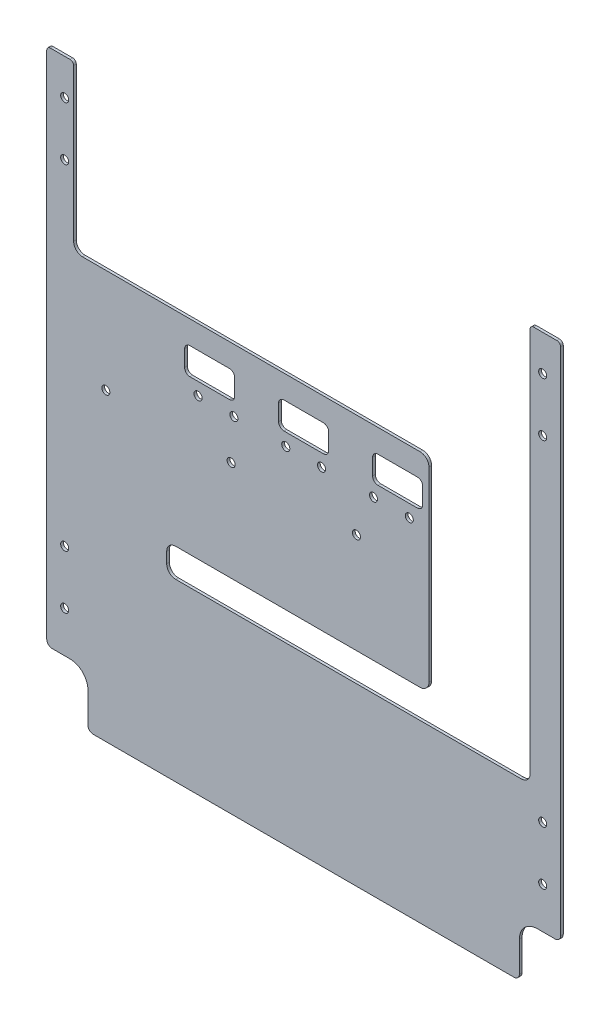
from build123d import *

# Parameters (mm, degrees)
ESQUISSE1_W                  = 287
ESQUISSE1_H                  = 320
BOSS_EXTRU_1_DEPTH           = 1.5
ENL_V_MAT_EXTRU_1_DEPTH      = 430.850264627
ENL_V_MAT_EXTRU_1_DEPTH_BACK = 430.850264627
ESQUISSE2_W                  = 23
ESQUISSE2_H                  = 30
CONG_1_R                     = 10
CONG_2_R                     = 3
ENL_V_MAT_EXTRU_2_DEPTH      = 430.850264627
ENL_V_MAT_EXTRU_2_DEPTH_BACK = 430.850264627
ESQUISSE3_W                  = 140
ESQUISSE3_H                  = 92
ENL_V_MAT_EXTRU_3_DEPTH      = 430.850264627
ENL_V_MAT_EXTRU_3_DEPTH_BACK = 430.850264627
ESQUISSE4_W                  = 56.5
ESQUISSE4_H                  = 222
ENL_V_MAT_EXTRU_4_DEPTH      = 430.850264627
ENL_V_MAT_EXTRU_4_DEPTH_BACK = 430.850264627
ESQUISSE5_W                  = 58.5
ESQUISSE5_H                  = 92
ENL_V_MAT_EXTRU_5_DEPTH      = 430.850264627
ENL_V_MAT_EXTRU_5_DEPTH_BACK = 430.850264627
ESQUISSE6_W                  = 146.5
ESQUISSE6_H                  = 16
CONG_3_R                     = 5
ENL_V_MAT_EXTRU_6_DEPTH      = 430.850264627
ENL_V_MAT_EXTRU_6_DEPTH_BACK = 430.850264627
ESQUISSE7_R                  = 2.25
ENL_V_MAT_EXTRU_7_DEPTH      = 430.850264627
ENL_V_MAT_EXTRU_7_DEPTH_BACK = 430.850264627
ESQUISSE8_R                  = 2.25
ENL_V_MAT_EXTRU_8_DEPTH      = 430.850264627
ENL_V_MAT_EXTRU_8_DEPTH_BACK = 430.850264627
ESQUISSE9_W                  = 28
ESQUISSE9_H                  = 15
CONG_4_R                     = 3
CONG_6_R                     = 2


with BuildPart() as part:
    # Esquisse1 → Boss.-Extru.1 (new body)
    with BuildSketch(Plane.XY):
        with Locations((143.5, 160)):
            Rectangle(ESQUISSE1_W, ESQUISSE1_H)
    extrude(amount=BOSS_EXTRU_1_DEPTH)

    # Esquisse2 → Enlèv. mat.-Extru.1 (cut, two sides: drawn at the far end of the back side and taken through both)
    with BuildSketch(Plane.XY.offset(1.5).offset(-ENL_V_MAT_EXTRU_1_DEPTH_BACK)):
        with Locations((275.5, 15)):
            Rectangle(ESQUISSE2_W, ESQUISSE2_H)
        with Locations((11.5, 15)):
            Rectangle(ESQUISSE2_W, ESQUISSE2_H)
    extrude(amount=ENL_V_MAT_EXTRU_1_DEPTH + ENL_V_MAT_EXTRU_1_DEPTH_BACK, mode=Mode.SUBTRACT)

    # Congé1
    cong_1_edges = [part.edges().sort_by_distance(p)[0] for p in [
        (264, 30, 0.75),
        (23, 30, 0.75),
    ]]
    fillet(cong_1_edges, radius=CONG_1_R)

    # Congé2
    cong_2_edges = [part.edges().sort_by_distance(p)[0] for p in [
        (287, 30, 0.75),
        (0, 30, 0.75),
        (23, 0, 0.75),
        (264, 0, 0.75),
    ]]
    fillet(cong_2_edges, radius=CONG_2_R)

    # Esquisse3 → Enlèv. mat.-Extru.2 (cut, two sides: drawn at the far end of the back side and taken through both)
    with BuildSketch(Plane.XY.offset(1.5).offset(-ENL_V_MAT_EXTRU_2_DEPTH_BACK)):
        with Locations((143.5, 274)):
            Rectangle(ESQUISSE3_W, ESQUISSE3_H)
    extrude(amount=ENL_V_MAT_EXTRU_2_DEPTH + ENL_V_MAT_EXTRU_2_DEPTH_BACK, mode=Mode.SUBTRACT)

    # Esquisse4 → Enlèv. mat.-Extru.3 (cut, two sides: drawn at the far end of the back side and taken through both)
    with BuildSketch(Plane.XY.offset(1.5).offset(-ENL_V_MAT_EXTRU_3_DEPTH_BACK)):
        with Locations((241.75, 209)):
            Rectangle(ESQUISSE4_W, ESQUISSE4_H)
    extrude(amount=ENL_V_MAT_EXTRU_3_DEPTH + ENL_V_MAT_EXTRU_3_DEPTH_BACK, mode=Mode.SUBTRACT)

    # Esquisse5 → Enlèv. mat.-Extru.4 (cut, two sides: drawn at the far end of the back side and taken through both)
    with BuildSketch(Plane.XY.offset(1.5).offset(-ENL_V_MAT_EXTRU_4_DEPTH_BACK)):
        with Locations((44.25, 274)):
            Rectangle(ESQUISSE5_W, ESQUISSE5_H)
    extrude(amount=ENL_V_MAT_EXTRU_4_DEPTH + ENL_V_MAT_EXTRU_4_DEPTH_BACK, mode=Mode.SUBTRACT)

    # Esquisse6 → Enlèv. mat.-Extru.5 (cut, two sides: drawn at the far end of the back side and taken through both)
    with BuildSketch(Plane.XY.offset(1.5).offset(-ENL_V_MAT_EXTRU_5_DEPTH_BACK)):
        with Locations((140.25, 106)):
            Rectangle(ESQUISSE6_W, ESQUISSE6_H)
    extrude(amount=ENL_V_MAT_EXTRU_5_DEPTH + ENL_V_MAT_EXTRU_5_DEPTH_BACK, mode=Mode.SUBTRACT)

    # Congé3
    cong_3_edges = [part.edges().sort_by_distance(p)[0] for p in [
        (270, 98, 0.75),
        (67, 98, 0.75),
        (67, 114, 0.75),
        (213.5, 114, 0.75),
        (213.5, 228, 0.75),
        (15, 228, 0.75),
    ]]
    fillet(cong_3_edges, radius=CONG_3_R)

    # Esquisse7 → Enlèv. mat.-Extru.6 (cut, two sides: drawn at the far end of the back side and taken through both)
    with BuildSketch(Plane.XY.offset(1.5).offset(-ENL_V_MAT_EXTRU_6_DEPTH_BACK)):
        with Locations((277, 300)):
            Circle(ESQUISSE7_R)
        with Locations((277, 270)):
            Circle(ESQUISSE7_R)
        with Locations((10, 270)):
            Circle(ESQUISSE7_R)
        with Locations((10, 300)):
            Circle(ESQUISSE7_R)
        with Locations((277, 83)):
            Circle(ESQUISSE7_R)
        with Locations((277, 53)):
            Circle(ESQUISSE7_R)
        with Locations((10, 53)):
            Circle(ESQUISSE7_R)
        with Locations((10, 83)):
            Circle(ESQUISSE7_R)
        with Locations((33, 170)):
            Circle(ESQUISSE7_R)
        with Locations((103, 170)):
            Circle(ESQUISSE7_R)
        with Locations((173, 170)):
            Circle(ESQUISSE7_R)
    extrude(amount=ENL_V_MAT_EXTRU_6_DEPTH + ENL_V_MAT_EXTRU_6_DEPTH_BACK, mode=Mode.SUBTRACT)

    # Esquisse8 → Enlèv. mat.-Extru.7 (cut, two sides: drawn at the far end of the back side and taken through both)
    with BuildSketch(Plane.XY.offset(1.5).offset(-ENL_V_MAT_EXTRU_7_DEPTH_BACK)):
        with Locations((133.5, 193)):
            Circle(ESQUISSE8_R)
        with Locations((153.5, 193)):
            Circle(ESQUISSE8_R)
        with Locations((182.5, 193)):
            Circle(ESQUISSE8_R)
        with Locations((202.5, 193)):
            Circle(ESQUISSE8_R)
        with Locations((84.5, 193)):
            Circle(ESQUISSE8_R)
        with Locations((104.5, 193)):
            Circle(ESQUISSE8_R)
    extrude(amount=ENL_V_MAT_EXTRU_7_DEPTH + ENL_V_MAT_EXTRU_7_DEPTH_BACK, mode=Mode.SUBTRACT)

    # Esquisse9 → Enlèv. mat.-Extru.8 (cut, two sides: drawn at the far end of the back side and taken through both)
    with BuildSketch(Plane.XY.offset(1.5).offset(-ENL_V_MAT_EXTRU_8_DEPTH_BACK)):
        with Locations((143.5, 207.5)):
            Rectangle(ESQUISSE9_W, ESQUISSE9_H)
        with Locations((196, 207.5)):
            Rectangle(ESQUISSE9_W, ESQUISSE9_H)
        with Locations((91, 207.5)):
            Rectangle(ESQUISSE9_W, ESQUISSE9_H)
    extrude(amount=ENL_V_MAT_EXTRU_8_DEPTH + ENL_V_MAT_EXTRU_8_DEPTH_BACK, mode=Mode.SUBTRACT)

    # Congé4
    cong_4_edges = [part.edges().sort_by_distance(p)[0] for p in [
        (157.5, 200, 0.75),
        (157.5, 215, 0.75),
        (129.5, 215, 0.75),
        (129.5, 200, 0.75),
        (210, 200, 0.75),
        (210, 215, 0.75),
        (182, 215, 0.75),
        (182, 200, 0.75),
        (105, 200, 0.75),
        (105, 215, 0.75),
        (77, 215, 0.75),
        (77, 200, 0.75),
    ]]
    fillet(cong_4_edges, radius=CONG_4_R)

    # Congé6
    cong_6_edges = [part.edges().sort_by_distance(p)[0] for p in [
        (287, 320, 0.75),
        (270, 320, 0.75),
        (0, 320, 0.75),
        (15, 320, 0.75),
    ]]
    fillet(cong_6_edges, radius=CONG_6_R)


solid = part.part
